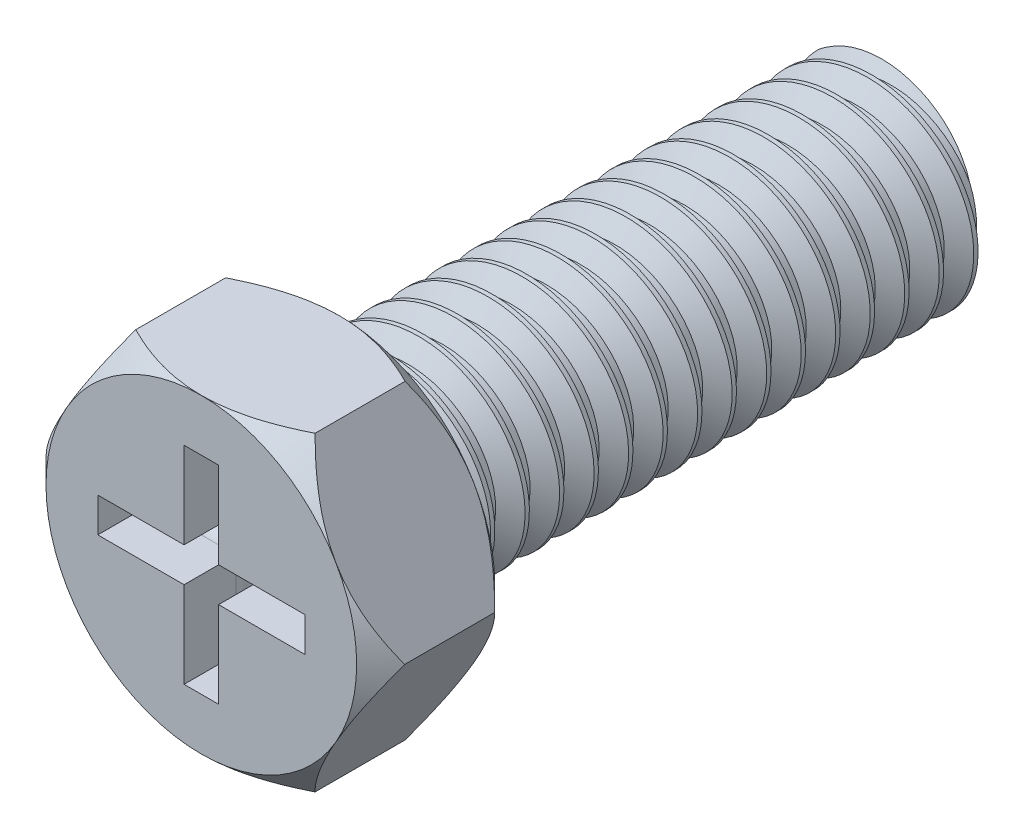
from build123d import *

# Parameters (mm, degrees)
BOSS_EXTRUDE1_DEPTH      = 2
BOSS_EXTRUDE2_DEPTH      = 2
BOSS_EXTRUDE2_DEPTH_BACK = 8
SKETCH1_3_R              = 1.5
THREAD1_PITCH            = 0.5
SKETCH1_8_OUTSIDE_W      = 11.622
SKETCH1_8_OUTSIDE_H      = 10.926
SKETCH1_8_OUTSIDE_R      = 2.25
CUT_EXTRUDE3_DEPTH       = 1
CUT_EXTRUDE3_DRAFT       = 45
SKETCH8_OUTSIDE_W        = 11.622
SKETCH8_OUTSIDE_H        = 10.926
SKETCH8_OUTSIDE_R        = 2.25
CUT_EXTRUDE4_DEPTH       = 1
CUT_EXTRUDE4_DRAFT       = -45
CUT_EXTRUDE5_DEPTH       = 1
FILLET1_R                = 0.25


with BuildPart() as part:
    # Sketch1 → Boss-Extrude1 (new body)
    with BuildSketch(Plane.XY):
        Polygon((2.598076211, 0), (1.299038106, 2.25), (-1.299038106, 2.25), (-2.598076211, 0), (-1.299038106, -2.25), (1.299038106, -2.25), align=None)
    extrude(amount=BOSS_EXTRUDE1_DEPTH)

    # Sketch1<3> → Boss-Extrude2 (add, two sides: drawn at the far end of the back side and taken through both)
    with BuildSketch(Plane.XY.offset(-BOSS_EXTRUDE2_DEPTH_BACK)):
        Circle(SKETCH1_3_R)
    extrude(amount=BOSS_EXTRUDE2_DEPTH + BOSS_EXTRUDE2_DEPTH_BACK)

    # Thread1: the profile of Thread Profile2 profile screwed along a right-hand helix of 16 turns, 6 arcs to a turn; built about Z, then put on its axis
    thread1_z = Axis((0, 0, 0), (0, 0, 1))
    thread1_corners = [(1.5003, 0, -0.000173205), (1.5003, 0, 0.437673204), (1.229367063, 0, 0.281249999), (1.229367063, 0, 0.156249999)]
    with BuildLine(mode=Mode.PRIVATE) as thread1_profile:
        Line(thread1_corners[0], thread1_corners[1])
        Line(thread1_corners[1], thread1_corners[2])
        Line(thread1_corners[2], thread1_corners[3])
        Line(thread1_corners[3], thread1_corners[0])
    thread1_cap = Face(thread1_profile.wire())
    thread1_turn_angles = [0, 30, 60, 90, 120, 150, 180, 210, 240, 270, 300, 330, 360]
    thread1_turn_weights = [1, 0.8660254037844387, 1, 0.8660254037844387, 1, 0.8660254037844387, 1, 0.8660254037844387, 1, 0.8660254037844387, 1, 0.8660254037844387, 1]
    thread1_turn_rails = [Edge.make_bspline([Vector(p[0], p[1], 0).rotate(thread1_z, thread1_turn_angles[k]) / thread1_turn_weights[k] + Vector(0, 0, p[2] + THREAD1_PITCH * thread1_turn_angles[k] / 360) for k in range(13)], [0, 0, 0, 1, 1, 2, 2, 3, 3, 4, 4, 5, 5, 6, 6, 6], 2, thread1_turn_weights) for p in thread1_corners]
    thread1_turn_sides = [Face.make_surface_from_curves(thread1_turn_rails[p[0]], thread1_turn_rails[p[1]]) for p in [(0, 1), (1, 2), (2, 3), (3, 0)]]
    thread1 = Plane(origin=(0, 0, 0), x_dir=(-1, 0, 0), z_dir=(0, 0, -1)) * Solid(Shell([*[p.moved(Location((0, 0, THREAD1_PITCH * i))) for i in range(16) for p in thread1_turn_sides], thread1_cap, thread1_cap.rotate(thread1_z, 5760).moved(Location((0, 0, THREAD1_PITCH * 5760 / 360)))]))
    add(thread1, mode=Mode.SUBTRACT)


with BuildPart() as cut_extrude3_tool:
    # Sketch1<8> outside → Cut-Extrude3 (with draft: the straight prism first)
    with BuildSketch(Plane.XY):
        Rectangle(SKETCH1_8_OUTSIDE_W, SKETCH1_8_OUTSIDE_H)
        Circle(SKETCH1_8_OUTSIDE_R, mode=Mode.SUBTRACT)
    extrude(amount=CUT_EXTRUDE3_DEPTH)
    # Cut-Extrude3: the draft: its side faces are tilted about the plane it starts from
    cut_extrude3_sides = [cut_extrude3_tool.faces().sort_by_distance(p)[0] for p in [
        (0, -5.463, 0.5),
        (5.811, 0, 0.5),
        (0, 5.463, 0.5),
        (-5.811, 0, 0.5),
        (-2.25, 0, 0.5),
    ]]
    draft(cut_extrude3_sides, Plane.XY, CUT_EXTRUDE3_DRAFT)


with BuildPart() as part_1:
    add(part.part)

    # Cut-Extrude3: cut by cut_extrude3_tool
    add(cut_extrude3_tool.part, mode=Mode.SUBTRACT)


with BuildPart() as cut_extrude4_tool:
    # Sketch8 outside → Cut-Extrude4 (with draft: the straight prism first)
    with BuildSketch(Plane.XY.offset(2)):
        Rectangle(SKETCH8_OUTSIDE_W, SKETCH8_OUTSIDE_H)
        Circle(SKETCH8_OUTSIDE_R, mode=Mode.SUBTRACT)
    extrude(amount=-CUT_EXTRUDE4_DEPTH)
    # Cut-Extrude4: the draft: its side faces are tilted about the plane it starts from
    cut_extrude4_sides = [cut_extrude4_tool.faces().sort_by_distance(p)[0] for p in [
        (0, -5.463, 1.5),
        (5.811, 0, 1.5),
        (0, 5.463, 1.5),
        (-5.811, 0, 1.5),
        (-2.25, 0, 1.5),
    ]]
    draft(cut_extrude4_sides, Plane.XY.offset(2), CUT_EXTRUDE4_DRAFT)


with BuildPart() as part_2:
    add(part_1.part)

    # Cut-Extrude4: cut by cut_extrude4_tool
    add(cut_extrude4_tool.part, mode=Mode.SUBTRACT)

    # Sketch10 → Cut-Extrude5 (cut)
    with BuildSketch(Plane.XY.offset(2)):
        Polygon((-0.25, -1.5), (0.25, -1.5), (0.25, -0.25), (1.5, -0.25), (1.5, 0.25), (0.25, 0.25), (0.25, 1.5), (-0.25, 1.5), (-0.25, 0.25), (-1.5, 0.25), (-1.5, -0.25), (-0.25, -0.25), align=None)
    extrude(amount=-CUT_EXTRUDE5_DEPTH, mode=Mode.SUBTRACT)

    # Fillet1
    fillet1_edges = [part_2.edges().sort_by_distance(p)[0] for p in [
        (-0.25, -0.875, 1),
        (-0.875, -0.25, 1),
        (-1.5, 0, 1),
        (-0.875, 0.25, 1),
        (-0.25, 0.875, 1),
        (0, 1.5, 1),
        (0.25, 0.875, 1),
        (0.875, 0.25, 1),
        (1.5, 0, 1),
        (0.875, -0.25, 1),
        (0.25, -0.875, 1),
        (0, -1.5, 1),
    ]]
    fillet(fillet1_edges, radius=FILLET1_R - 0.0001)  # a hair under: the kernel refuses the full size


solid = part_2.part
